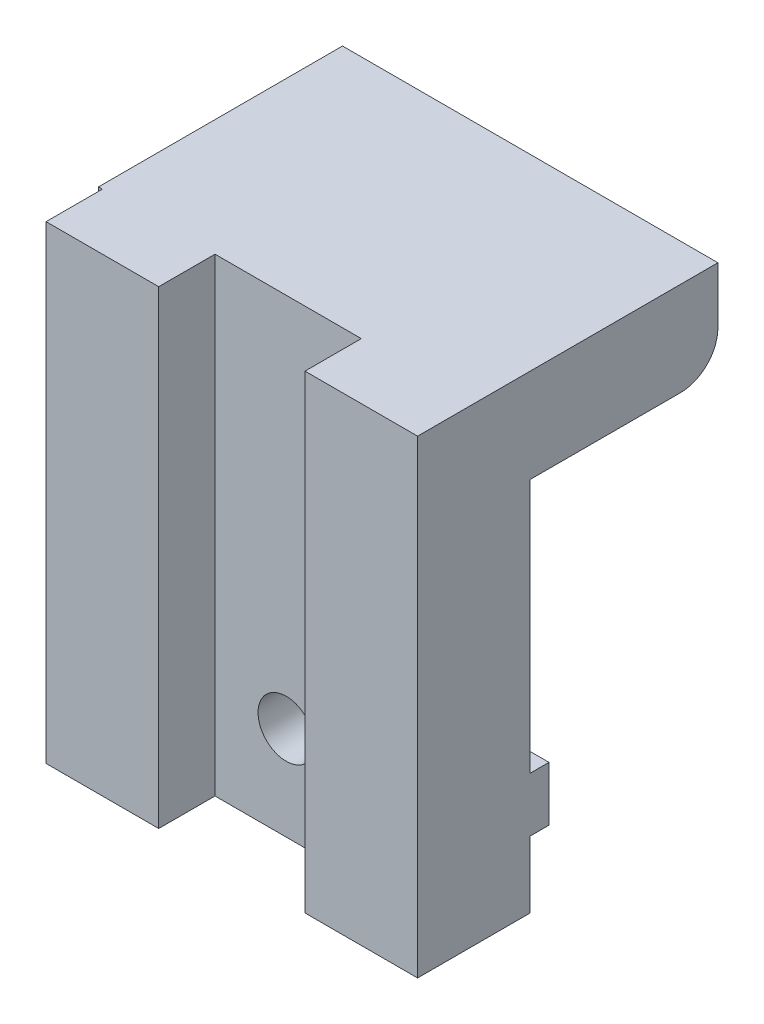
from build123d import *

# Parameters (mm, degrees)
ESQUISSE1_W             = 20
ESQUISSE1_H             = 25
BOSS_EXTRU_1_DEPTH      = 3
ESQUISSE2_W             = 20
ESQUISSE2_H             = 5
BOSS_EXTRU_2_DEPTH      = 10
CONG_2_R                = 2
ESQUISSE3_W             = 20
ESQUISSE3_H             = 2.9
BOSS_EXTRU_3_DEPTH      = 1
ESQUISSE4_R             = 1.5
ENL_V_MAT_EXTRU_1_DEPTH = 21.621590627
ESQUISSE5_W             = 6
ESQUISSE5_H             = 25
BOSS_EXTRU_4_DEPTH      = 3


with BuildPart() as part:
    # Esquisse1 → Boss.-Extru.1 (new body)
    with BuildSketch(Plane.XY):
        Rectangle(ESQUISSE1_W, ESQUISSE1_H)
    extrude(amount=BOSS_EXTRU_1_DEPTH)

    # Esquisse2 → Boss.-Extru.2 (add)
    with BuildSketch(Plane(origin=(0, 0, 0), x_dir=(-1, 0, 0), z_dir=(0, 0, -1))):
        with Locations((0, 10)):
            Rectangle(ESQUISSE2_W, ESQUISSE2_H)
    extrude(amount=BOSS_EXTRU_2_DEPTH)

    # Congé2
    cong_2_edges = [part.edges().sort_by_distance(p)[0] for p in [
        (0, 7.5, -10),
    ]]
    fillet(cong_2_edges, radius=CONG_2_R)

    # Esquisse3 → Boss.-Extru.3 (add)
    with BuildSketch(Plane(origin=(0, 0, 0), x_dir=(-1, 0, 0), z_dir=(0, 0, -1))):
        with Locations((0, -7.5)):
            Rectangle(ESQUISSE3_W, ESQUISSE3_H)
    extrude(amount=BOSS_EXTRU_3_DEPTH)

    # Esquisse4 → Enlèv. mat.-Extru.1 (cut, through all)
    with BuildSketch(Plane.XY.offset(3)):
        with Locations((0, -7.5)):
            Circle(ESQUISSE4_R)
    extrude(amount=-ENL_V_MAT_EXTRU_1_DEPTH, mode=Mode.SUBTRACT)

    # Esquisse5 → Boss.-Extru.4 (add)
    with BuildSketch(Plane.XY.offset(3)):
        with Locations((-6.791749633, 0)):
            Rectangle(ESQUISSE5_W, ESQUISSE5_H)
        with Locations((7, 0)):
            Rectangle(ESQUISSE5_W, ESQUISSE5_H)
    extrude(amount=BOSS_EXTRU_4_DEPTH)


solid = part.part
